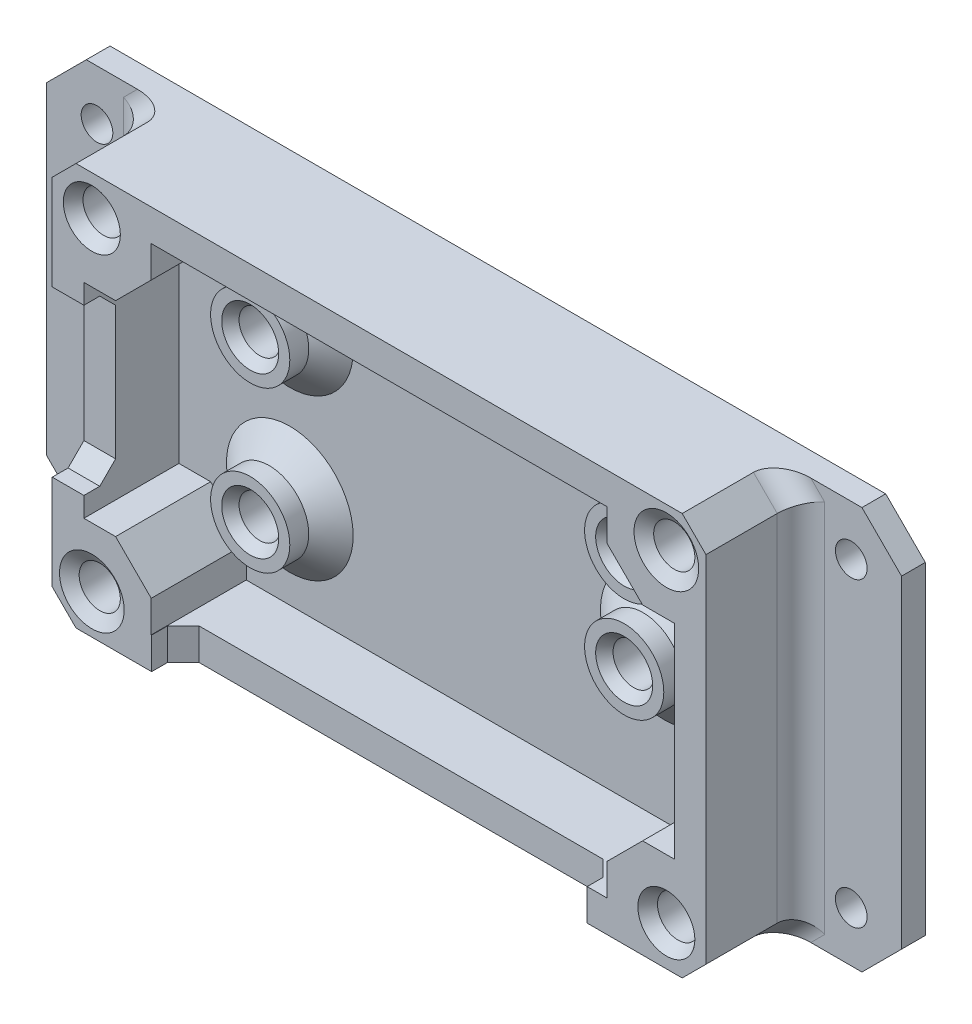
from build123d import *
from OCP.BRepFilletAPI import BRepFilletAPI_MakeChamfer

# Parameters (mm, degrees)
SKETCH1_W           = 107.95
SKETCH1_H           = 50.8
BOSS_EXTRUDE1_DEPTH = 3
SKETCH2_W           = 82.55
SKETCH2_H           = 50.8
SKETCH2_W_2         = 74.55
SKETCH2_H_2         = 42.8
BOSS_EXTRUDE2_DEPTH = 12
SKETCH3_R           = 5
SKETCH3_R_2         = 2.6
BOSS_EXTRUDE3_DEPTH = 5
CUT_EXTRUDE1_REACH  = 77.624
SKETCH4_W           = 55
SKETCH4_H           = 4
CUT_EXTRUDE2_REACH  = 101.713
SKETCH5_W           = 4
SKETCH5_H           = 20.8
SKETCH6_R           = 2.5
BOSS_EXTRUDE4_DEPTH = 12
CHAMFER1_SIZE       = 3
CHAMFER2_SIZE       = 3
CHAMFER2_SIZE_2     = 2.607860213
CHAMFER3_SIZE       = 1
CHAMFER3_SIZE2      = 1.191753593
SKETCH7_R           = 2.6
CUT_EXTRUDE3_DEPTH  = 6
CHAMFER4_SIZE       = 2
SKETCH8_R           = 2
CUT_EXTRUDE4_DEPTH  = 61.847848154
CHAMFER5_SIZE       = 5
FILLET1_R           = 3
CHAMFER6_SIZE       = 1
CHAMFER6_SIZE2      = 1.482560969


with BuildPart() as part:
    # Sketch1 → Boss-Extrude1 (new body)
    with BuildSketch(Plane.XY):
        Rectangle(SKETCH1_W, SKETCH1_H)
    extrude(amount=BOSS_EXTRUDE1_DEPTH)

    # Sketch2 → Boss-Extrude2 (add)
    with BuildSketch(Plane.XY.offset(3)):
        Rectangle(SKETCH2_W, SKETCH2_H)
        Rectangle(SKETCH2_W_2, SKETCH2_H_2, mode=Mode.SUBTRACT)
    extrude(amount=BOSS_EXTRUDE2_DEPTH)

    # Sketch3 → Boss-Extrude3 (add)
    # profile 1 of 4: a face of its own
    with BuildSketch(Plane.XY.offset(3)):
        with Locations((-23.275, 10.4)):
            Circle(SKETCH3_R)
        with Locations((-23.275, 10.4)):
            Circle(SKETCH3_R_2, mode=Mode.SUBTRACT)
    # profile 2 of 4: a face of its own
    with BuildSketch(Plane.XY.offset(3)):
        with Locations((-23.275, -9.823019498)):
            Circle(SKETCH3_R)
        with Locations((-23.275, -9.823019498)):
            Circle(SKETCH3_R_2, mode=Mode.SUBTRACT)
    # profile 3 of 4: a face of its own
    with BuildSketch(Plane.XY.offset(3)):
        with Locations((23.951190028, 10.4)):
            Circle(SKETCH3_R)
        with Locations((23.951190028, 10.4)):
            Circle(SKETCH3_R_2, mode=Mode.SUBTRACT)
    # profile 4 of 4: a face of its own
    with BuildSketch(Plane.XY.offset(3)):
        with Locations((23.951190028, -2.3)):
            Circle(SKETCH3_R)
        with Locations((23.951190028, -2.3)):
            Circle(SKETCH3_R_2, mode=Mode.SUBTRACT)
    extrude(amount=BOSS_EXTRUDE3_DEPTH)

    # Sketch4 → Cut-Extrude1 (cut, up to next)
    with BuildSketch(Plane.XZ.offset(25.4), mode=Mode.PRIVATE) as cut_extrude1_sk1:
        with Locations((-1.225, 13)):
            Rectangle(SKETCH4_W, SKETCH4_H)
    cut_extrude1_tool1 = extrude(cut_extrude1_sk1.sketch, amount=-CUT_EXTRUDE1_REACH, mode=Mode.PRIVATE) & part.part
    add(cut_extrude1_tool1.solids().sort_by_distance((-1.225, -25.4, 13))[0], mode=Mode.SUBTRACT)

    # Sketch5 → Cut-Extrude2 (cut, up to next)
    with BuildSketch(Plane.ZY.offset(41.275), mode=Mode.PRIVATE) as cut_extrude2_sk1:
        with Locations((13, 0)):
            Rectangle(SKETCH5_W, SKETCH5_H)
    cut_extrude2_tool1 = extrude(cut_extrude2_sk1.sketch, amount=-CUT_EXTRUDE2_REACH, mode=Mode.PRIVATE) & part.part
    add(cut_extrude2_tool1.solids().sort_by_distance((-41.275, 0, 13))[0], mode=Mode.SUBTRACT)

    # Sketch6 → Boss-Extrude4 (add)
    with BuildSketch(Plane.XY.offset(15)):
        with BuildLine():
            Line((-33.275, 12.9), (-28.775, 17.4))
            Line((-28.775, 17.4), (-28.775, 21.4))
            Line((-28.775, 21.4), (-33.983712153, 21.4))
            ThreePointArc((-33.983712153, 21.4), (-33.827734218, 20.910774109), (-33.775, 20.4))
            ThreePointArc((-33.775, 20.4), (-34.905693606, 18.308349934), (-37.275, 18.108712153))
            Line((-37.275, 18.108712153), (-37.275, 12.9))
            Line((-37.275, 12.9), (-33.275, 12.9))
        make_face()
        with Locations((-36.275, -20.4)):
            Circle(SKETCH6_R)
        Polygon((-37.275, -12.9), (-37.275, -21.4), (-28.775, -21.4), (-28.775, -17.4), (-33.275, -12.9), align=None)
        with BuildLine():
            Line((37.275, -18.108712153), (37.275, -12.9))
            Line((37.275, -12.9), (33.275, -12.9))
            Line((33.275, -12.9), (28.775, -17.4))
            Line((28.775, -17.4), (28.775, -21.4))
            Line((28.775, -21.4), (33.983712153, -21.4))
            ThreePointArc((33.983712153, -21.4), (34.507233047, -18.632233047), (37.275, -18.108712153))
        make_face()
        with BuildLine():
            Line((33.983712153, 21.4), (28.775, 21.4))
            Line((28.775, 21.4), (28.775, 17.4))
            Line((28.775, 17.4), (33.275, 12.9))
            Line((33.275, 12.9), (37.275, 12.9))
            Line((37.275, 12.9), (37.275, 18.108712153))
            ThreePointArc((37.275, 18.108712153), (34.507233047, 18.632233047), (33.983712153, 21.4))
        make_face()
        with BuildLine():
            ThreePointArc((-33.775, 20.4), (-33.827734218, 20.910774109), (-33.983712153, 21.4))
            Line((-33.983712153, 21.4), (-37.275, 21.4))
            Line((-37.275, 21.4), (-37.275, 18.108712153))
            ThreePointArc((-37.275, 18.108712153), (-34.905693606, 18.308349934), (-33.775, 20.4))
        make_face()
        with BuildLine():
            Line((-37.275, 21.4), (-33.983712153, 21.4))
            ThreePointArc((-33.983712153, 21.4), (-38.042766953, 22.167766953), (-37.275, 18.108712153))
            Line((-37.275, 18.108712153), (-37.275, 21.4))
        make_face()
        with BuildLine():
            ThreePointArc((-37.275, -18.108712153), (-38.042766953, -22.167766953), (-33.983712153, -21.4))
            Line((-33.983712153, -21.4), (-37.275, -21.4))
            Line((-37.275, -21.4), (-37.275, -18.108712153))
        make_face()
        with BuildLine():
            Line((-37.275, -21.4), (-33.983712153, -21.4))
            ThreePointArc((-33.983712153, -21.4), (-33.827734218, -20.910774109), (-33.775, -20.4))
            ThreePointArc((-33.775, -20.4), (-34.905693606, -18.308349934), (-37.275, -18.108712153))
            Line((-37.275, -18.108712153), (-37.275, -21.4))
        make_face()
        with BuildLine():
            ThreePointArc((38.775, 20.4), (36.785774109, 22.847265782), (33.983712153, 21.4))
            Line((33.983712153, 21.4), (37.275, 21.4))
            Line((37.275, 21.4), (37.275, 18.108712153))
            ThreePointArc((37.275, 18.108712153), (38.366650066, 19.030693606), (38.775, 20.4))
        make_face()
        with BuildLine():
            Line((37.275, 21.4), (33.983712153, 21.4))
            ThreePointArc((33.983712153, 21.4), (34.507233047, 18.632233047), (37.275, 18.108712153))
            Line((37.275, 18.108712153), (37.275, 21.4))
        make_face()
        with BuildLine():
            ThreePointArc((38.775, -20.4), (38.366650066, -19.030693606), (37.275, -18.108712153))
            Line((37.275, -18.108712153), (37.275, -21.4))
            Line((37.275, -21.4), (33.983712153, -21.4))
            ThreePointArc((33.983712153, -21.4), (36.785774109, -22.847265782), (38.775, -20.4))
        make_face()
        with BuildLine():
            Line((37.275, -21.4), (37.275, -18.108712153))
            ThreePointArc((37.275, -18.108712153), (34.507233047, -18.632233047), (33.983712153, -21.4))
            Line((33.983712153, -21.4), (37.275, -21.4))
        make_face()
    extrude(amount=-BOSS_EXTRUDE4_DEPTH)

    # Chamfer1
    chamfer1_edges = [part.edges().sort_by_distance(p)[0] for p in [
        (-41.275, 25.4, 9),
        (-41.275, -25.4, 9),
        (41.275, -25.4, 9),
        (41.275, 25.4, 9),
    ]]
    chamfer(chamfer1_edges, length=CHAMFER1_SIZE)

    # Chamfer2
    # the kernel refuses this chamfer: 3, 2.607860213 mm, written as the material it adds along each edge
    with BuildSketch(Plane(origin=(-23.275, 10.4, 3), x_dir=(1, 0, 0), z_dir=(0, -1, 0))) as chamfer2_piece_1:
        Polygon((5 + CHAMFER2_SIZE, 0), (5, CHAMFER2_SIZE_2), (5, 0), align=None)
    revolve(axis=Axis((-23.275, 10.4, 3), (0, 0, 1)))
    with BuildSketch(Plane(origin=(-23.275, -9.823019498, 3), x_dir=(1, 0, 0), z_dir=(0, -1, 0))) as chamfer2_piece_2:
        Polygon((5 + CHAMFER2_SIZE, 0), (5, CHAMFER2_SIZE_2), (5, 0), align=None)
    revolve(axis=Axis((-23.275, -9.823019498, 3), (0, 0, 1)))
    with BuildSketch(Plane(origin=(23.951190028, 10.4, 3), x_dir=(1, 0, 0), z_dir=(0, -1, 0))) as chamfer2_piece_3:
        Polygon((5 + CHAMFER2_SIZE, 0), (5, CHAMFER2_SIZE_2), (5, 0), align=None)
    revolve(axis=Axis((23.951190028, 10.4, 3), (0, 0, 1)))
    with BuildSketch(Plane(origin=(23.951190028, -2.3, 3), x_dir=(1, 0, 0), z_dir=(0, -1, 0))) as chamfer2_piece_4:
        Polygon((5 + CHAMFER2_SIZE, 0), (5, CHAMFER2_SIZE_2), (5, 0), align=None)
    revolve(axis=Axis((23.951190028, -2.3, 3), (0, 0, 1)))

    # Chamfer3: one chamfer whose edges measure the first distance from different faces: ONE call of the kernel's chamfer builder (chamfer() names one face for all edges)
    chamfer3_edges_1 = [part.edges().sort_by_distance(p)[0] for p in [
        (-25.875, 10.4, 8),
    ]]
    chamfer3_side_1 = [part.faces().sort_by_distance(p)[0] for p in [
        (-28.133578644, 10.4, 8),
    ]]
    chamfer3_edges_2 = [part.edges().sort_by_distance(p)[0] for p in [
        (-25.875, -9.823019498, 8),
    ]]
    chamfer3_side_2 = [part.faces().sort_by_distance(p)[0] for p in [
        (-28.133578644, -9.823019498, 8),
    ]]
    chamfer3_edges_3 = [part.edges().sort_by_distance(p)[0] for p in [
        (21.351190028, 10.4, 8),
    ]]
    chamfer3_side_3 = [part.faces().sort_by_distance(p)[0] for p in [
        (19.092611384, 10.4, 8),
    ]]
    chamfer3_edges_4 = [part.edges().sort_by_distance(p)[0] for p in [
        (21.351190028, -2.3, 8),
    ]]
    chamfer3_side_4 = [part.faces().sort_by_distance(p)[0] for p in [
        (19.092611384, -2.3, 8),
    ]]
    chamfer3 = BRepFilletAPI_MakeChamfer(part.part.solid().wrapped)
    for e in chamfer3_edges_1:
        chamfer3.Add(CHAMFER3_SIZE, CHAMFER3_SIZE2, e.wrapped, chamfer3_side_1[0].wrapped)  # the first distance lies on this face
    for e in chamfer3_edges_2:
        chamfer3.Add(CHAMFER3_SIZE, CHAMFER3_SIZE2, e.wrapped, chamfer3_side_2[0].wrapped)  # the first distance lies on this face
    for e in chamfer3_edges_3:
        chamfer3.Add(CHAMFER3_SIZE, CHAMFER3_SIZE2, e.wrapped, chamfer3_side_3[0].wrapped)  # the first distance lies on this face
    for e in chamfer3_edges_4:
        chamfer3.Add(CHAMFER3_SIZE, CHAMFER3_SIZE2, e.wrapped, chamfer3_side_4[0].wrapped)  # the first distance lies on this face
    add(Compound.cast(chamfer3.Shape()), mode=Mode.REPLACE)

    # Sketch7 → Cut-Extrude3 (cut)
    with BuildSketch(Plane.XY.offset(15)):
        with Locations((-36.275, 20.4)):
            Circle(SKETCH7_R)
        with Locations((-36.275, -20.4)):
            Circle(SKETCH7_R)
        with Locations((36.275, 20.4)):
            Circle(SKETCH7_R)
        with Locations((36.275, -20.4)):
            Circle(SKETCH7_R)
    extrude(amount=-CUT_EXTRUDE3_DEPTH, mode=Mode.SUBTRACT)

    # Chamfer4
    chamfer4_edges = [part.edges().sort_by_distance(p)[0] for p in [
        (26.275, -23.4, 11),
        (-28.725, -23.4, 11),
        (-39.275, 10.4, 11),
        (-39.275, -10.4, 11),
    ]]
    chamfer(chamfer4_edges, length=CHAMFER4_SIZE)

    # Sketch8 → Cut-Extrude4 (cut, through all)
    with BuildSketch(Plane.XY.offset(3)):
        with Locations((-47.625, 19.05)):
            Circle(SKETCH8_R)
        with Locations((-47.625, -19.05)):
            Circle(SKETCH8_R)
        with Locations((47.625, 19.05)):
            Circle(SKETCH8_R)
        with Locations((47.625, -19.05)):
            Circle(SKETCH8_R)
    extrude(amount=-CUT_EXTRUDE4_DEPTH, mode=Mode.SUBTRACT)

    # Chamfer5
    chamfer5_edges = [part.edges().sort_by_distance(p)[0] for p in [
        (-53.975, 25.4, 1.5),
        (53.975, 25.4, 1.5),
        (53.975, -25.4, 1.5),
        (-53.975, -25.4, 1.5),
    ]]
    chamfer(chamfer5_edges, length=CHAMFER5_SIZE)

    # Fillet1
    fillet1_edges = [part.edges().sort_by_distance(p)[0] for p in [
        (-41.275, 0, 3),
        (41.275, 0, 3),
        (-39.775, 23.9, 3),
        (39.775, 23.9, 3),
        (39.775, -23.9, 3),
        (-39.775, -23.9, 3),
    ]]
    fillet(fillet1_edges, radius=FILLET1_R)

    # Chamfer6: one chamfer whose edges measure the first distance from different faces: ONE call of the kernel's chamfer builder (chamfer() names one face for all edges)
    chamfer6_edges_1 = [part.edges().sort_by_distance(p)[0] for p in [
        (-38.875, -20.4, 15),
    ]]
    chamfer6_side_1 = [part.faces().sort_by_distance(p)[0] for p in [
        (-38.875, -20.4, 12),
    ]]
    chamfer6_edges_2 = [part.edges().sort_by_distance(p)[0] for p in [
        (33.675, 20.4, 15),
    ]]
    chamfer6_side_2 = [part.faces().sort_by_distance(p)[0] for p in [
        (33.675, 20.4, 12),
    ]]
    chamfer6_edges_3 = [part.edges().sort_by_distance(p)[0] for p in [
        (33.675, -20.4, 15),
        (-38.875, 20.4, 15),
    ]]
    chamfer6_side_3 = [part.faces().sort_by_distance(p)[0] for p in [
        (-40.305714567, 16.4, 15),
    ]]
    chamfer6 = BRepFilletAPI_MakeChamfer(part.part.solid().wrapped)
    for e in chamfer6_edges_1:
        chamfer6.Add(CHAMFER6_SIZE, CHAMFER6_SIZE2, e.wrapped, chamfer6_side_1[0].wrapped)  # the first distance lies on this face
    for e in chamfer6_edges_2:
        chamfer6.Add(CHAMFER6_SIZE, CHAMFER6_SIZE2, e.wrapped, chamfer6_side_2[0].wrapped)  # the first distance lies on this face
    for e in chamfer6_edges_3:
        chamfer6.Add(CHAMFER6_SIZE, CHAMFER6_SIZE2, e.wrapped, chamfer6_side_3[0].wrapped)  # the first distance lies on this face
    add(Compound.cast(chamfer6.Shape()), mode=Mode.REPLACE)


solid = part.part
